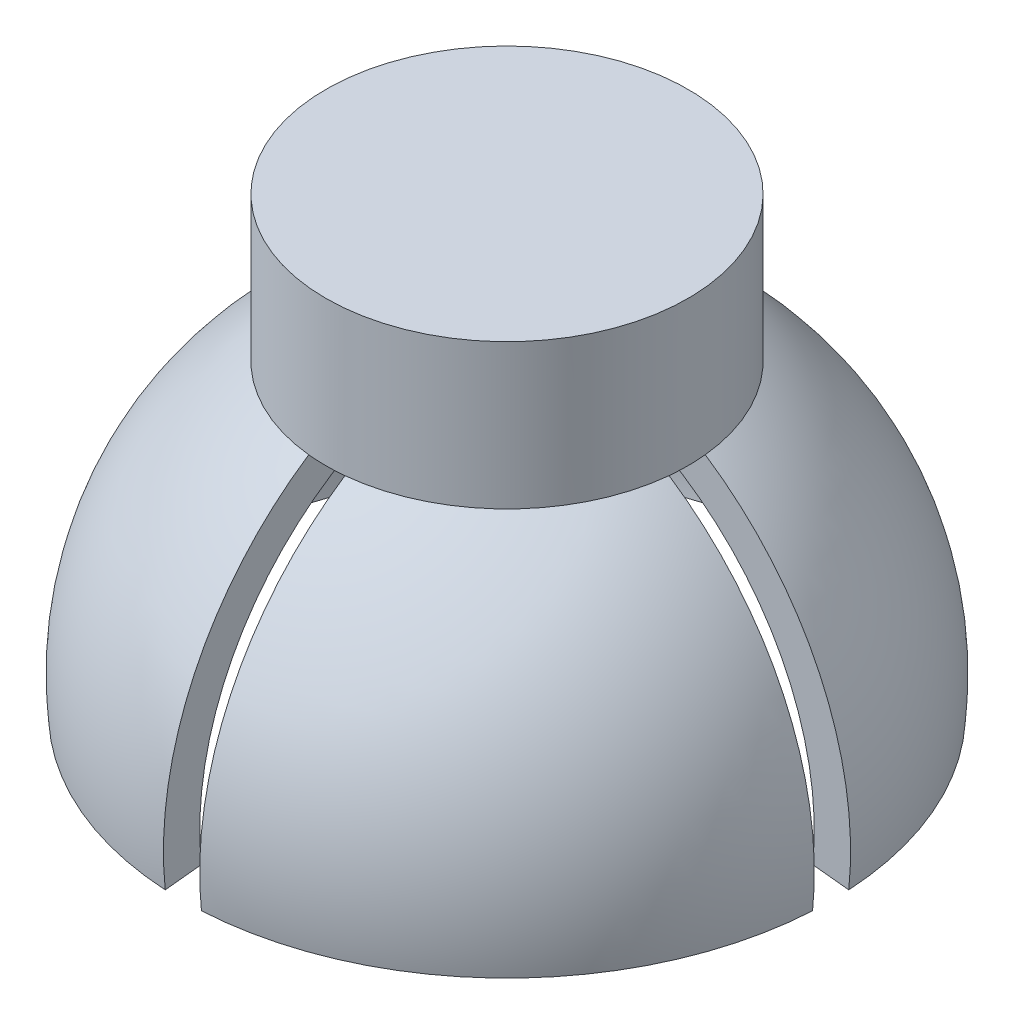
from build123d import *

# Parameters (mm, degrees)
SKETCH2_W          = 0.5
SKETCH2_H          = 4.212035472
CUT_EXTRUDE1_DEPTH = 10
CIRPATTERN1_COUNT  = 4


with BuildPart() as part:
    # Sketch1 → Revolve1 (revolve)
    with BuildSketch(Plane.XY):
        with BuildLine():
            Line((0, 5.741657387), (0, 4))
            ThreePointArc((0, 4), (2.972579302, 2.676522425), (3.978087581, -0.418113853))
            Line((3.978087581, -0.418113853), (4.475348529, -0.470378085))
            ThreePointArc((4.475348529, -0.470378085), (4.07420943, 1.91071126), (2.5, 3.741657387))
            Line((2.5, 3.741657387), (2.5, 5.741657387))
            Line((2.5, 5.741657387), (0, 5.741657387))
        make_face()
    revolve(axis=Axis((0, 5.741657387, 0), (0, -1, 0)))

    # Sketch2 → Cut-Extrude1 (cut)
    with BuildSketch(Plane.XY):
        with Locations((0, 1.635639651)):
            Rectangle(SKETCH2_W, SKETCH2_H)
    cut_extrude1 = extrude(amount=-CUT_EXTRUDE1_DEPTH, mode=Mode.SUBTRACT)

    # CirPattern1: Cut-Extrude1 ×4 about axis
    cirpattern1_axis = Axis((0, -0.470378085, 0), (0, 1, 0))
    for i in range(1, CIRPATTERN1_COUNT):
        add(cut_extrude1.rotate(cirpattern1_axis, i * 360 / CIRPATTERN1_COUNT), mode=Mode.SUBTRACT)


solid = part.part
